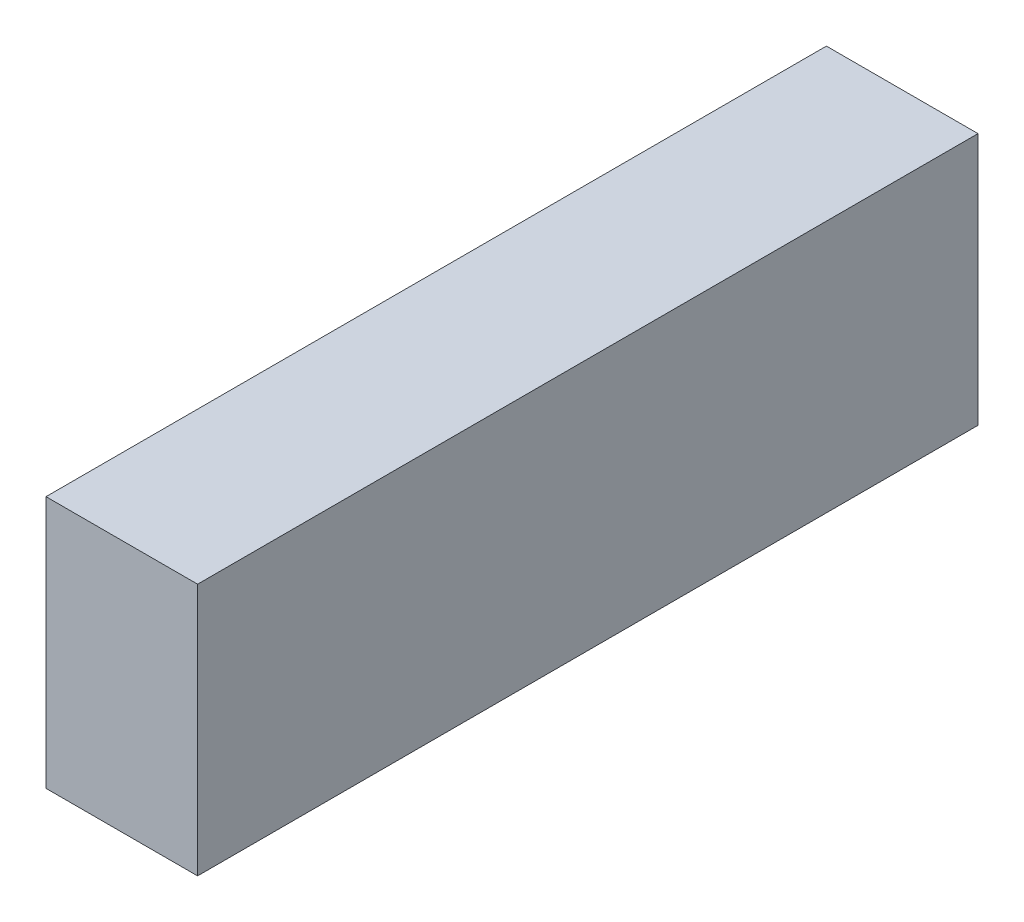
from build123d import *

# Parameters (mm, degrees)
SKETCH1_W           = 27
SKETCH1_H           = 45
BOSS_EXTRUDE1_DEPTH = 69.5


with BuildPart() as part:
    # Sketch1 → Boss-Extrude1 (new, symmetric)
    with BuildSketch(Plane.XY):
        Rectangle(SKETCH1_W, SKETCH1_H)
    extrude(amount=BOSS_EXTRUDE1_DEPTH, both=True)


solid = part.part
